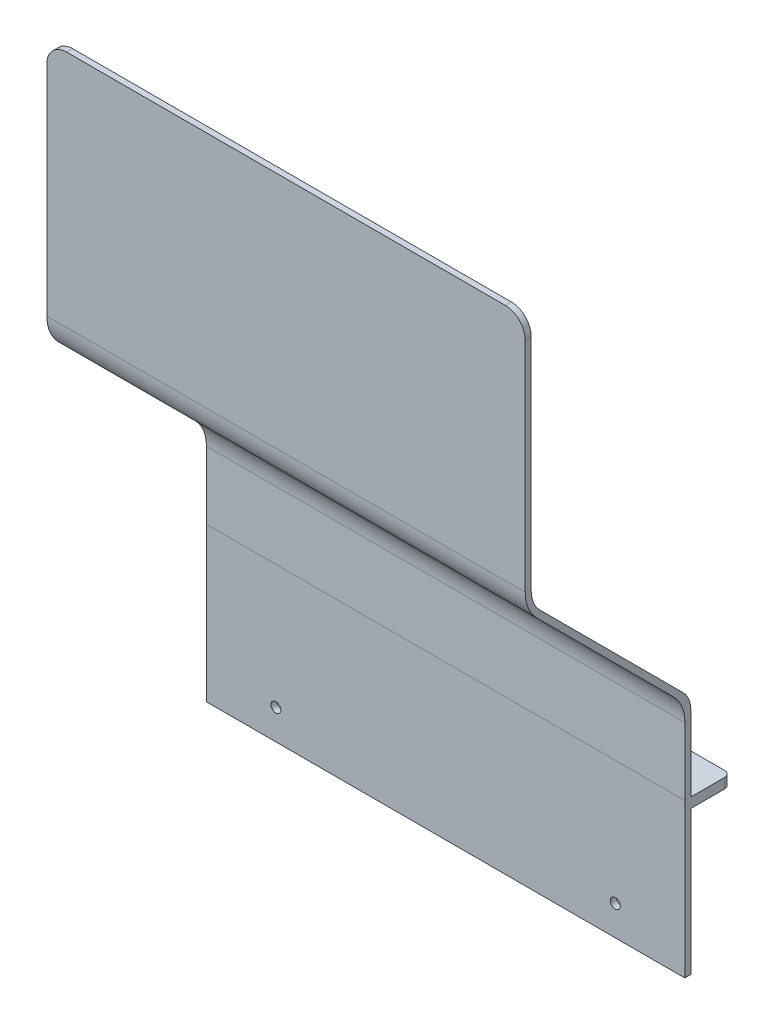
from build123d import *

# Parameters (mm, degrees)
SKETCH1_W           = 250
SKETCH1_H           = 72
BOSS_EXTRUDE1_DEPTH = 3
SKETCH2_W           = 239.6
SKETCH2_H           = 23
BOSS_EXTRUDE2_DEPTH = 5
SKETCH3_R           = 2.5
CUT_EXTRUDE1_DEPTH  = 5
FILLET1_R           = 3
SKETCH4_R           = 2.5
CUT_EXTRUDE2_DEPTH  = 5
SKETCH6_W           = 5.2
SKETCH6_H           = 72
CUT_EXTRUDE3_DEPTH  = 5
BOSS_EXTRUDE3_DEPTH = 239.6
SKETCH8_W           = 239.6
SKETCH8_H           = 10
BOSS_EXTRUDE4_DEPTH = 3
FILLET3_R           = 10


with BuildPart() as part:
    # Sketch1 → Boss-Extrude1 (new body)
    with BuildSketch(Plane.XY):
        Rectangle(SKETCH1_W, SKETCH1_H)
    extrude(amount=BOSS_EXTRUDE1_DEPTH)

    # Sketch2 → Boss-Extrude2 (add)
    with BuildSketch(Plane(origin=(0, 36, 0), x_dir=(1, 0, 0), z_dir=(0, 1, 0))):
        with Locations((0, 8.5)):
            Rectangle(SKETCH2_W, SKETCH2_H)
    extrude(amount=BOSS_EXTRUDE2_DEPTH)

    # Sketch3 → Cut-Extrude1 (cut)
    with BuildSketch(Plane(origin=(0, 41, 0), x_dir=(1, 0, 0), z_dir=(0, 1, 0))):
        with Locations((-65, 8.5)):
            Circle(SKETCH3_R)
        with Locations((65, 8.5)):
            Circle(SKETCH3_R)
    extrude(amount=-CUT_EXTRUDE1_DEPTH, mode=Mode.SUBTRACT)

    # Fillet1
    fillet1_edges = [part.edges().sort_by_distance(p)[0] for p in [
        (119.8, 38.5, -20),
        (-119.8, 38.5, -20),
    ]]
    fillet(fillet1_edges, radius=FILLET1_R)

    # Sketch4 → Cut-Extrude2 (cut)
    with BuildSketch(Plane.XY.offset(3)):
        with Locations((-85, -21)):
            Circle(SKETCH4_R)
        with Locations((85, -21)):
            Circle(SKETCH4_R)
    extrude(amount=-CUT_EXTRUDE2_DEPTH, mode=Mode.SUBTRACT)

    # Sketch6 → Cut-Extrude3 (cut)
    with BuildSketch(Plane.XY.offset(3)):
        with Locations((-122.4, 0)):
            Rectangle(SKETCH6_W, SKETCH6_H)
        with Locations((122.4, 0)):
            Rectangle(SKETCH6_W, SKETCH6_H)
    extrude(amount=-CUT_EXTRUDE3_DEPTH, mode=Mode.SUBTRACT)

    # Sketch7 → Boss-Extrude3 (add)
    with BuildSketch(Plane.ZY.offset(119.8)):
        with BuildLine():
            Line((0, 41), (3, 41))
            Line((3, 41), (2.916490723, 74.715728753))
            add(Edge.make_bspline(
                [(2.916490723, 74.715728753), (3.032377234, 82.951998235), (8.774355099, 88.857864376)],
                knots=[0, 0, 0, 1, 1, 1], degree=2))
            Line((8.774355099, 88.857864376), (77.058626347, 157.142135624))
            add(Edge.make_bspline(
                [(77.058626347, 157.142135624), (82.800604212, 163.048001765), (82.916490723, 171.284271247)],
                knots=[0, 0, 0, 1, 1, 1], degree=2))
            Line((82.916490723, 171.284271247), (82.916490723, 280.703287287))
            Line((82.916490723, 280.703287287), (79.916490723, 280.703287287))
            Line((79.916490723, 280.703287287), (79.916490723, 170.455844123))
            ThreePointArc((79.916490723, 170.455844123), (78.774683711, 164.715592637), (75.523092441, 159.849242405))
            Line((75.523092441, 159.849242405), (3.803620061, 88.129770025))
            ThreePointArc((3.803620061, 88.129770025), (0.988528647, 83.916687992), (0, 78.947018888))
            Line((0, 78.947018888), (0, 41))
        make_face()
    extrude(amount=-BOSS_EXTRUDE3_DEPTH)

    # Sketch8 → Boss-Extrude4 (add)
    with BuildSketch(Plane.XY.offset(82.916490723)):
        with Locations((0, 285.703287287)):
            Rectangle(SKETCH8_W, SKETCH8_H)
    extrude(amount=-BOSS_EXTRUDE4_DEPTH)

    # Fillet3
    fillet3_edges = [part.edges().sort_by_distance(p)[0] for p in [
        (119.8, 290.703287287, 81.416490723),
        (-119.8, 290.703287287, 81.416490723),
    ]]
    fillet(fillet3_edges, radius=FILLET3_R)


solid = part.part
